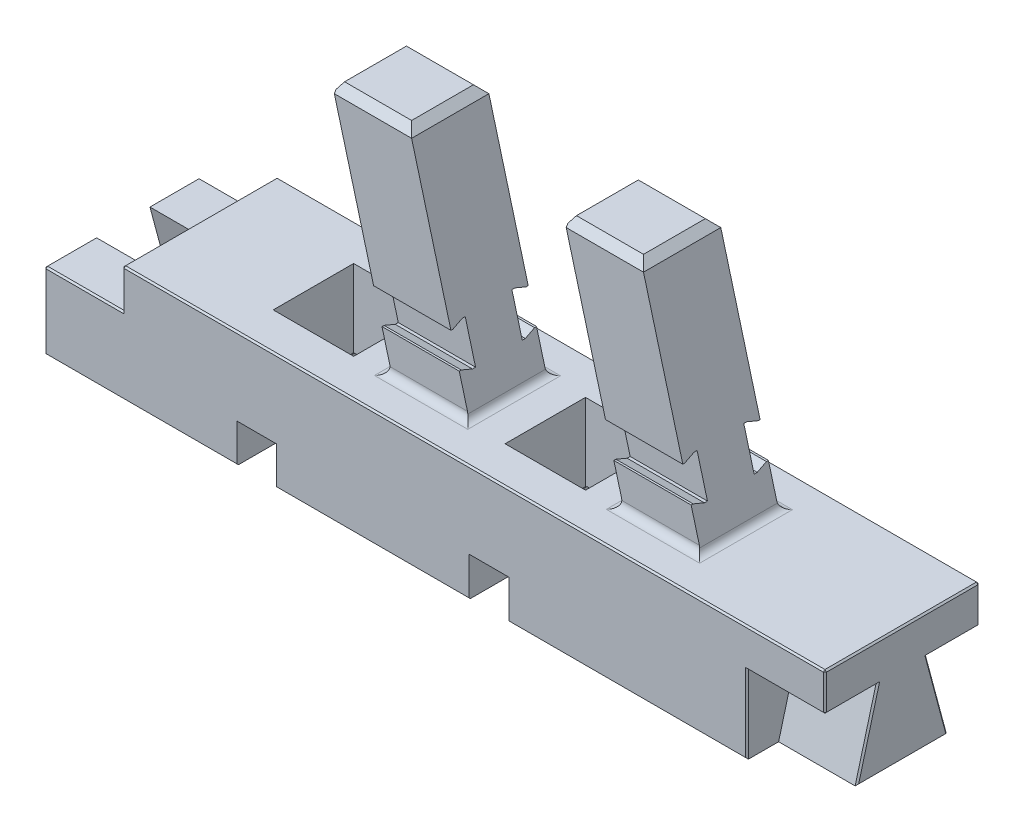
from build123d import *
from OCP.BRepFilletAPI import BRepFilletAPI_MakeChamfer

# Parameters (mm, degrees)
SKETCH2_W                     = 80
SKETCH2_H                     = 20
BOSS_EXTRUDE1_DEPTH           = 15
BOSS_EXTRUDE2_DEPTH           = 5
CUT_EXTRUDE1_DEPTH            = 5
SKETCH6_W                     = 5
SKETCH6_H                     = 5
CUT_EXTRUDE2_DEPTH            = 51.395549721
SLOT_EXTRUDE_DEPTH            = 51.395549721
SKETCH10_W                    = 5
SKETCH10_H                    = 10
CUT_EXTRUDE8_DEPTH            = 5
BOSS_EXTRUDE3_DEPTH           = 20.980762114
FILLET1_R                     = 1
CHAMFER1_SIZE                 = 1
CHAMFER2_SIZE                 = 0.73205
CHAMFER2_SIZE2                = 0.597716322
CHAMFER2_SIZE2_2              = 1.035275038
LPATTERN1_COUNT               = 2
LPATTERN1_PITCH               = 30
FILLET1_OF_LPATTERN1_R        = 1
CHAMFER1_OF_LPATTERN1_SIZE    = 1
CHAMFER2_OF_LPATTERN1_SIZE    = 0.73205
CHAMFER2_OF_LPATTERN1_SIZE2   = 0.597716322
CHAMFER2_OF_LPATTERN1_SIZE2_2 = 1.035275038
BOSS_EXTRUDE4_DEPTH           = 10.980762114
CUT_EXTRUDE9_START            = -80
CUT_EXTRUDE9_DEPTH            = 10
MOVE_START                    = -5.2
MOVE_FACE1_DEPTH              = 10.4
MOVE_START_2                  = -10
MOVE_FACE1_2_OUTLINE_W        = 0.2
MOVE_FACE1_2_OUTLINE_H        = 5
MOVE_FACE1_2_DEPTH            = 20
MOVE_START_3                  = -40
MOVE_FACE2_DEPTH              = 10.1
MOVE_START_4                  = 50.880762114
MOVE_FACE2_2_DEPTH            = 10.1
BOSS_EXTRUDE5_DEPTH           = 0.1
MOVE_FACE3_BY                 = 0.1
MOVE_FACE3_2_BY               = 0.1
MOVE_FACE3_3_BY               = 0.1
MOVE_FACE3_4_BY               = 0.1
BOSS_EXTRUDE6_DEPTH           = 0.1
MOVE_START_5                  = -2.542539714
MOVE_FACE5_DEPTH              = 41.339745962
CHAMFER3_SIZE                 = 0.2
CHAMFER3_SIZE2                = 0.163299316


# Read off the part's stored shape, not the designer's step: Move Face1, Move Face2, Move Face5
with BuildPart() as part:
    # Sketch2 → Boss-Extrude1 (new body)
    with BuildSketch(Plane(origin=(0, 0, 0), x_dir=(1, 0, 0), z_dir=(0, 1, 0))):
        Rectangle(SKETCH2_W, SKETCH2_H)
    extrude(amount=-BOSS_EXTRUDE1_DEPTH)

    # Sketch3 → Boss-Extrude2 (add, symmetric)
    with BuildSketch(Plane.XY):
        Polygon((40, 0), (30, 0), (22.235428647, 28.977774789), (32.235428647, 28.977774789), align=None)
    boss_extrude2 = extrude(amount=BOSS_EXTRUDE2_DEPTH, both=True)

    # Sketch4 → Cut-Extrude1 (cut, symmetric)
    with BuildSketch(Plane.XY):
        Polygon((19.019237886, -15), (29.019237886, -15), (25, 0), (15, 0), align=None)
    cut_extrude1 = extrude(amount=CUT_EXTRUDE1_DEPTH, both=True, mode=Mode.SUBTRACT)

    # Sketch6 → Cut-Extrude2 (cut, symmetric)
    with BuildSketch(Plane.XY):
        with Locations((17.5, -12.5)):
            Rectangle(SKETCH6_W, SKETCH6_H)
    cut_extrude2 = extrude(amount=CUT_EXTRUDE2_DEPTH, both=True, mode=Mode.SUBTRACT)

    # Sketch8 → Slot Extrude (cut, symmetric)
    with BuildSketch(Plane(origin=(0, 0, 0), x_dir=(0, 0, -1), z_dir=(1, 0, 0))):
        Polygon((-4.725252258, 8.904847108), (-5, 8.804847108), (-5, 6.988887394), (-3.120614758, 6.988887394), (-3.120614758, 9.388887394), (-3.3953625, 9.388887394), align=None)
        Polygon((-3.120614758, 6.988887394), (-5, 6.988887394), (-5, 5.172927681), (-4.725252258, 5.072927681), (-3.3953625, 4.588887394), (-3.120614758, 4.588887394), align=None)
        Polygon((5, 5.172927681), (5, 8.804847108), (4.725252258, 8.904847108), (3.3953625, 9.388887394), (3.120614758, 9.388887394), (3.120614758, 4.588887394), (3.3953625, 4.588887394), (4.725252258, 5.072927681), align=None)
        Polygon((4.725252258, 8.904847108), (5, 8.804847108), (5, 8.904847108), align=None)
        Polygon((5, 5.072927681), (5, 5.172927681), (4.725252258, 5.072927681), align=None)
        Polygon((-5, 8.904847108), (-5, 8.804847108), (-4.725252258, 8.904847108), align=None)
        Polygon((-4.725252258, 5.072927681), (-5, 5.172927681), (-5, 5.072927681), align=None)
    slot_extrude = extrude(amount=SLOT_EXTRUDE_DEPTH, both=True, mode=Mode.SUBTRACT)

    # Sketch10 → Cut-Extrude8 (cut, symmetric)
    with BuildSketch(Plane.XY):
        with Locations((17.5, -5)):
            Rectangle(SKETCH10_W, SKETCH10_H)
    cut_extrude8 = extrude(amount=CUT_EXTRUDE8_DEPTH, both=True, mode=Mode.SUBTRACT)

    # Sketch12 → Boss-Extrude3 (add)
    with BuildSketch(Plane(origin=(40, 0, 0), x_dir=(0, 0, -1), z_dir=(1, 0, 0))):
        Polygon((6, -15), (3.320508076, -5), (-3.320508076, -5), (-6, -15), (0, -15), align=None)
        Polygon((10, -5), (10, 0), (5, 0), (-5, 0), (-10, 0), (-10, -5), (-3.320508076, -5), (3.320508076, -5), align=None)
    extrude(amount=BOSS_EXTRUDE3_DEPTH)

    # Fillet1
    fillet1_edges = [part.edges().sort_by_distance(p)[0] for p in [
        (30, 0, 0),
        (40, 0, 0),
        (35, 0, -5),
        (35, 0, 5),
    ]]
    fillet(fillet1_edges, radius=FILLET1_R)

    # Chamfer1
    chamfer1_edges = [part.edges().sort_by_distance(p)[0] for p in [
        (27.235428647, 28.977774789, -5),
        (27.235428647, 28.977774789, 5),
    ]]
    chamfer(chamfer1_edges, length=CHAMFER1_SIZE)

    # Chamfer2: one chamfer whose edges measure the first distance from different faces: ONE call of the kernel's chamfer builder (chamfer() names one face for all edges)
    chamfer2_edges_1 = [part.edges().sort_by_distance(p)[0] for p in [
        (22.235428647, 28.977774789, 0),
    ]]
    chamfer2_side_1 = [part.faces().sort_by_distance(p)[0] for p in [
        (25.827075596, 15.57356589, 0),
    ]]
    chamfer2_edges_2 = [part.edges().sort_by_distance(p)[0] for p in [
        (32.235428647, 28.977774789, 0),
    ]]
    chamfer2_side_2 = [part.faces().sort_by_distance(p)[0] for p in [
        (27.235428647, 28.977774789, 0),
    ]]
    chamfer2 = BRepFilletAPI_MakeChamfer(part.part.solid().wrapped)
    for e in chamfer2_edges_1:
        chamfer2.Add(CHAMFER2_SIZE, CHAMFER2_SIZE2, e.wrapped, chamfer2_side_1[0].wrapped)  # the first distance lies on this face
    for e in chamfer2_edges_2:
        chamfer2.Add(CHAMFER2_SIZE, CHAMFER2_SIZE2_2, e.wrapped, chamfer2_side_2[0].wrapped)  # the first distance lies on this face
    add(Compound.cast(chamfer2.Shape()), mode=Mode.REPLACE)

    # LPattern1: Boss-Extrude2, Cut-Extrude1, Cut-Extrude2, Slot Extrude, Cut-Extrude8 ×2
    with Locations(*[(-i * LPATTERN1_PITCH, 0, 0) for i in range(1, LPATTERN1_COUNT)]):
        add(boss_extrude2)
        add(cut_extrude1, mode=Mode.SUBTRACT)
        add(cut_extrude2, mode=Mode.SUBTRACT)
        add(slot_extrude, mode=Mode.SUBTRACT)
        add(cut_extrude8, mode=Mode.SUBTRACT)

    # Fillet1 of LPattern1
    fillet1_of_lpattern1_edges = [part.edges().sort_by_distance(p)[0] for p in [
        (0, 0, 0),
        (10, 0, 0),
        (5, 0, -5),
        (5, 0, 5),
    ]]
    fillet(fillet1_of_lpattern1_edges, radius=FILLET1_OF_LPATTERN1_R)

    # Chamfer1 of LPattern1
    chamfer1_of_lpattern1_edges = [part.edges().sort_by_distance(p)[0] for p in [
        (-2.764571353, 28.977774789, -5),
        (-2.764571353, 28.977774789, 5),
    ]]
    chamfer(chamfer1_of_lpattern1_edges, length=CHAMFER1_OF_LPATTERN1_SIZE)

    # Chamfer2 of LPattern1: one chamfer whose edges measure the first distance from different faces: ONE call of the kernel's chamfer builder (chamfer() names one face for all edges)
    chamfer2_of_lpattern1_edges_1 = [part.edges().sort_by_distance(p)[0] for p in [
        (-7.764571353, 28.977774789, 0),
    ]]
    chamfer2_of_lpattern1_side_1 = [part.faces().sort_by_distance(p)[0] for p in [
        (-4.172924404, 15.57356589, 0),
    ]]
    chamfer2_of_lpattern1_edges_2 = [part.edges().sort_by_distance(p)[0] for p in [
        (2.235428647, 28.977774789, 0),
    ]]
    chamfer2_of_lpattern1_side_2 = [part.faces().sort_by_distance(p)[0] for p in [
        (-2.764571353, 28.977774789, 0),
    ]]
    chamfer2_of_lpattern1 = BRepFilletAPI_MakeChamfer(part.part.solid().wrapped)
    for e in chamfer2_of_lpattern1_edges_1:
        chamfer2_of_lpattern1.Add(CHAMFER2_OF_LPATTERN1_SIZE, CHAMFER2_OF_LPATTERN1_SIZE2, e.wrapped, chamfer2_of_lpattern1_side_1[0].wrapped)  # the first distance lies on this face
    for e in chamfer2_of_lpattern1_edges_2:
        chamfer2_of_lpattern1.Add(CHAMFER2_OF_LPATTERN1_SIZE, CHAMFER2_OF_LPATTERN1_SIZE2_2, e.wrapped, chamfer2_of_lpattern1_side_2[0].wrapped)  # the first distance lies on this face
    add(Compound.cast(chamfer2_of_lpattern1.Shape()), mode=Mode.REPLACE)

    # Sketch12<5> → Boss-Extrude4 (add)
    with BuildSketch(Plane(origin=(40, 0, 0), x_dir=(0, 0, -1), z_dir=(1, 0, 0))):
        Polygon((10, -15), (10, -5), (3.320508076, -5), (6, -15), align=None)
        Polygon((-6, -15), (-3.320508076, -5), (-10, -5), (-10, -15), align=None)
    extrude(amount=BOSS_EXTRUDE4_DEPTH)

    # Sketch12<6> → Cut-Extrude9 (cut)
    with BuildSketch(Plane(origin=(40, 0, 0), x_dir=(0, 0, -1), z_dir=(1, 0, 0)).offset(CUT_EXTRUDE9_START)):
        Polygon((6, -15), (3.320508076, -5), (-3.320508076, -5), (-6, -15), (0, -15), align=None)
        Polygon((10, -5), (10, 0), (5, 0), (-5, 0), (-10, 0), (-10, -5), (-3.320508076, -5), (3.320508076, -5), align=None)
    extrude(amount=CUT_EXTRUDE9_DEPTH, mode=Mode.SUBTRACT)

    # Move Face1 outline → Move Face1 (cut)
    with BuildSketch(Plane.XY.offset(MOVE_START)):
        Polygon((29.226293123, -15), (25.207055236, 0), (14.8, 0), (14.8, -15), (15, -15), (15, -10), (20, -10), (20, -15), align=None)
        Polygon((-0.773706877, -15), (-4.792944764, 0), (-15.2, 0), (-15.2, -15), (-15, -15), (-15, -10), (-10, -10), (-10, -15), align=None)
    extrude(amount=MOVE_FACE1_DEPTH, mode=Mode.SUBTRACT)

    # Move Face1 2 outline → Move Face1 2 (cut)
    with BuildSketch(Plane.XY.offset(MOVE_START_2)):
        with Locations((14.9, -12.5)):
            Rectangle(MOVE_FACE1_2_OUTLINE_W, MOVE_FACE1_2_OUTLINE_H)
        with Locations((-15.1, -12.5)):
            Rectangle(MOVE_FACE1_2_OUTLINE_W, MOVE_FACE1_2_OUTLINE_H)
    extrude(amount=MOVE_FACE1_2_DEPTH, mode=Mode.SUBTRACT)

    # Move Face2 outline → Move Face2 (cut)
    with BuildSketch(Plane.YZ.offset(MOVE_START_3)):
        Polygon((-15, -6.103527618), (-5.1, -3.450830613), (-5.1, -10), (0, -10), (0, 10), (-5.1, 10), (-5.1, 3.450830613), (-15, 6.103527618), align=None)
    extrude(amount=MOVE_FACE2_DEPTH, mode=Mode.SUBTRACT)

    # Move Face2 2 outline → Move Face2 2 (cut)
    with BuildSketch(Plane.YZ.offset(MOVE_START_4)):
        Polygon((-4.9, -3.190185538), (-15, -5.896472382), (-15, -10), (-4.9, -10), align=None)
        Polygon((-15, 5.896472382), (-4.9, 3.190185538), (-4.9, 10), (-15, 10), align=None)
    extrude(amount=MOVE_FACE2_2_DEPTH, mode=Mode.SUBTRACT)

    # Sketch13 → Boss-Extrude5 (add)
    with BuildSketch(Plane(origin=(14.8, 0, 0), x_dir=(0, 0, -1), z_dir=(1, 0, 0))):
        Polygon((5.2, -10), (-5.2, -10), (-10, -10), (-10, -15), (10, -15), (10, -10), align=None)
    extrude(amount=BOSS_EXTRUDE5_DEPTH)

    # Move Face3: a face moved inward by 0.1
    extrude(part.faces().sort_by_distance((17.45, -10, 7.6))[0], amount=MOVE_FACE3_BY, dir=(0, 1, 0), mode=Mode.SUBTRACT)

    # Move Face3 2: a face moved inward by 0.1
    extrude(part.faces().sort_by_distance((20, -12.5, 7.6))[0], amount=MOVE_FACE3_2_BY, dir=(1, 0, 0), mode=Mode.SUBTRACT)

    # Move Face3 3: a face moved inward by 0.1
    extrude(part.faces().sort_by_distance((20, -12.5, -7.6))[0], amount=MOVE_FACE3_3_BY, dir=(1, 0, 0), mode=Mode.SUBTRACT)

    # Move Face3 4: a face moved inward by 0.1
    extrude(part.faces().sort_by_distance((17.45, -10, -7.6))[0], amount=MOVE_FACE3_4_BY, dir=(0, 1, 0), mode=Mode.SUBTRACT)

    # Sketch16 → Boss-Extrude6 (add)
    with BuildSketch(Plane(origin=(-15.2, 0, 0), x_dir=(0, 0, -1), z_dir=(1, 0, 0))):
        Polygon((5.2, -10), (-5.2, -10), (-10, -10), (-10, -15), (10, -15), (10, -10), align=None)
    extrude(amount=BOSS_EXTRUDE6_DEPTH)

    # Move Face5 outline → Move Face5 (cut)
    with BuildSketch(Plane.YZ.offset(MOVE_START_5)):
        Polygon((9.004847108, 4.742884956), (9.004847108, 5), (8.904847108, 5), (8.904847108, 4.725252258), (9.388887394, 3.3953625), (9.388887394, 3.120614758), (4.588887394, 3.120614758), (4.588887394, 3.3953625), (5.072927681, 4.725252258), (5.072927681, 5), (4.972927681, 5), (4.972927681, 4.742884956), (4.488887394, 3.412995198), (4.488887394, 3.020614758), (9.488887394, 3.020614758), (9.488887394, 3.412995198), align=None)
        Polygon((8.904847108, -5), (9.004847108, -5), (9.004847108, -4.742884956), (9.488887394, -3.412995198), (9.488887394, -3.020614758), (4.488887394, -3.020614758), (4.488887394, -3.412995198), (4.972927681, -4.742884956), (4.972927681, -5), (5.072927681, -5), (5.072927681, -4.725252258), (4.588887394, -3.3953625), (4.588887394, -3.120614758), (9.388887394, -3.120614758), (9.388887394, -3.3953625), (8.904847108, -4.725252258), align=None)
    extrude(amount=MOVE_FACE5_DEPTH, mode=Mode.SUBTRACT)

    # Chamfer3: one chamfer whose edges measure the first distance from different faces: ONE call of the kernel's chamfer builder (chamfer() names one face for all edges)
    chamfer3_edges_1 = [part.edges().sort_by_distance(p)[0] for p in [
        (35.490381057, -15, -10),
        (60.980762114, -9.95, -4.54332896),
        (60.980762114, -4.9, -6.595092769),
        (55.930762114, -4.9, -10),
        (60.980762114, -4.9, 6.595092769),
        (55.930762114, -4.9, 10),
        (60.980762114, -2.45, -10),
        (60.980762114, 0, 0),
        (60.980762114, -2.45, 10),
        (60.980762114, -9.95, 4.54332896),
        (60.980762114, -15, 0),
        (2.45, -15, 10),
        (-27.55, -15, -10),
        (2.45, -15, -10),
        (35.490381057, -15, 10),
        (-40, -15, -8.051763809),
        (15.540381057, 0, -10),
        (50.880762114, -9.95, 10),
        (50.880762114, -9.95, -10),
        (15.540381057, 0, 10),
        (-40, -5.1, 6.725415307),
        (-34.95, -5.1, 10),
        (-40, -10.05, -4.777179116),
        (-40, -5.1, -6.725415307),
        (-29.9, -2.55, -10),
        (-34.95, -5.1, -10),
        (-29.9, 0, 0),
        (-29.9, -2.55, 10),
        (-40, -10.05, 4.777179116),
        (-40, -10.05, -10),
        (-40, -10.05, 10),
        (-27.55, -15, 10),
    ]]
    chamfer3_edges_2 = [part.edges().sort_by_distance(p)[0] for p in [
        (55.930762114, -15, -5.896472382),
    ]]
    chamfer3_side_2 = [part.faces().sort_by_distance(p)[0] for p in [
        (40.901792788, -15, 0),
    ]]
    chamfer3 = BRepFilletAPI_MakeChamfer(part.part.solid().wrapped)
    for e in chamfer3_edges_1:
        chamfer3.Add(CHAMFER3_SIZE, e.wrapped)
    for e in chamfer3_edges_2:
        chamfer3.Add(CHAMFER3_SIZE, CHAMFER3_SIZE2, e.wrapped, chamfer3_side_2[0].wrapped)  # the first distance lies on this face
    add(Compound.cast(chamfer3.Shape()), mode=Mode.REPLACE)


solid = part.part
